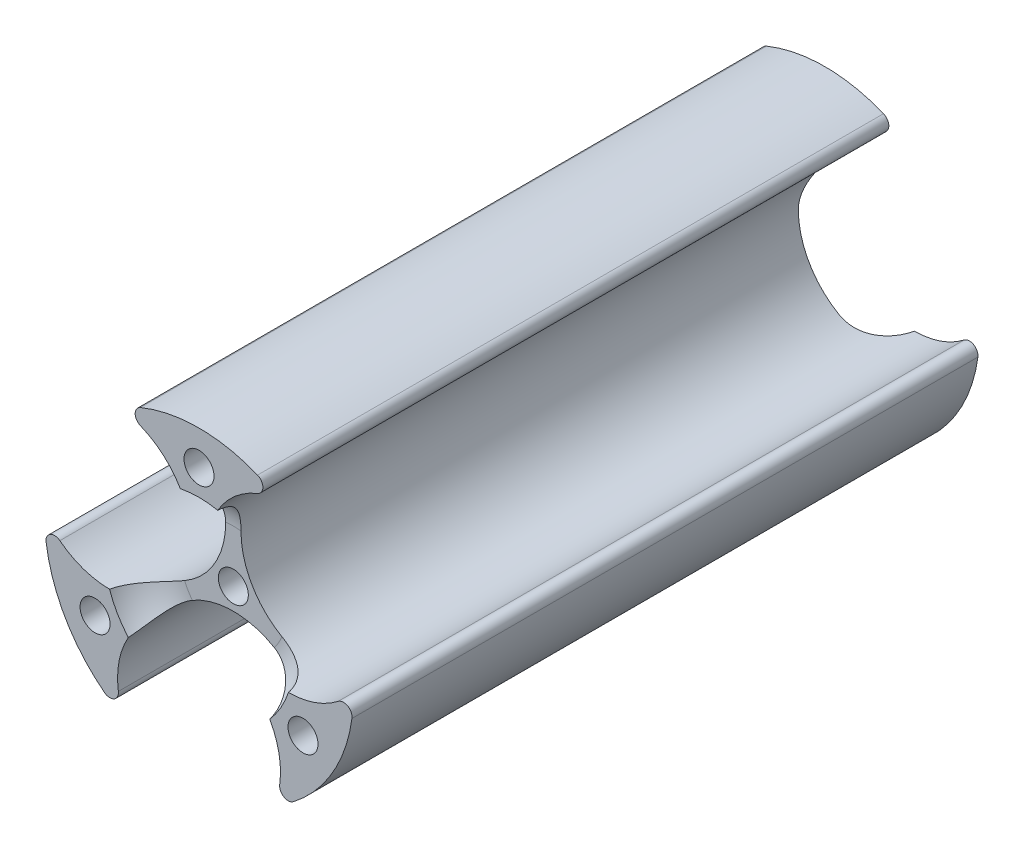
from build123d import *

# Parameters (mm, degrees)
SKETCH_1_R      = 1.75
EXTRUDE_1_DEPTH = 65
FILLET_1_R      = 1
SKETCH_2_R      = 1.75
EXTRUDE_2_DEPTH = 4
FILLET_2_R      = 5
EXTRUDE_START   = 4
SKETCH_3_R      = 1.75
EXTRUDE_3_DEPTH = 4
FILLET_3_R      = 5


with BuildPart() as part:
    # Эскиз1 → Бобышка-Вытянуть1 (new body)
    with BuildSketch(Plane.XY):
        with BuildLine():
            ThreePointArc((8.733013025, -15.739583333), (15.511193288, -9.132517877), (18, 0))
            ThreePointArc((18, 0), (17.999346369, 0.153395838), (17.997385524, 0.306780536))
            ThreePointArc((17.997385524, 0.306780536), (2.165063509, 1.25), (9.264372499, 15.432802798))
            ThreePointArc((9.264372499, 15.432802798), (0, 18), (-9.264372499, 15.432802798))
            ThreePointArc((-9.264372499, 15.432802798), (-3.287188474, 12.30613363), (-0.892304845, 6))
            ThreePointArc((-0.892304845, 6), (-7.392160386, -3.013830108), (-17.997385524, 0.306780536))
            ThreePointArc((-17.997385524, 0.306780536), (-15.588457268, -9), (-8.733013025, -15.739583333))
            ThreePointArc((-8.733013025, -15.739583333), (-1.908713738, -2.693721911), (9.5, -12))
            ThreePointArc((9.5, -12), (9.306278089, -13.908713738), (8.733013025, -15.739583333))
        make_face()
        with Locations((-12.124355653, -7)):
            Circle(SKETCH_1_R, mode=Mode.SUBTRACT)
        with Locations((12.124355653, -7)):
            Circle(SKETCH_1_R, mode=Mode.SUBTRACT)
        Circle(SKETCH_1_R, mode=Mode.SUBTRACT)
        with Locations((0, 14)):
            Circle(SKETCH_1_R, mode=Mode.SUBTRACT)
    extrude(amount=EXTRUDE_1_DEPTH)

    # Скругление1
    fillet_1_edges = [part.edges().sort_by_distance(p)[0] for p in [
        (17.997385524, 0.306780536, 32.5),
        (8.733013025, -15.739583333, 32.5),
        (-8.733013025, -15.739583333, 32.5),
        (-17.997385524, 0.306780536, 32.5),
        (-9.264372499, 15.432802798, 32.5),
        (9.264372499, 15.432802798, 32.5),
    ]]
    fillet(fillet_1_edges, radius=FILLET_1_R)

    # Эскиз2 → Бобышка-Вытянуть2 (add)
    # profile 1 of 3: a face of its own
    with BuildSketch(Plane.XY.offset(65)):
        with BuildLine():
            ThreePointArc((6.822193962, 14.803653121), (7.446391133, 15.728518462), (6.825592394, 16.655668359))
            ThreePointArc((6.825592394, 16.655668359), (0, 18), (-6.825592394, 16.655668359))
            ThreePointArc((-6.825592394, 16.655668359), (-7.446391133, 15.728518462), (-6.822193962, 14.803653121))
            ThreePointArc((-6.822193962, 14.803653121), (-4.168730882, 13.177543251), (-2.183145185, 10.781181619))
            ThreePointArc((-2.183145185, 10.781181619), (0, 11), (2.183145185, 10.781181619))
            ThreePointArc((2.183145185, 10.781181619), (4.168730882, 13.177543251), (6.822193962, 14.803653121))
        make_face()
        with Locations((0, 14)):
            Circle(SKETCH_2_R, mode=Mode.SUBTRACT)
    # profile 2 of 3: a face of its own
    with BuildSketch(Plane.XY.offset(65)):
        with BuildLine():
            ThreePointArc((17.837028113, -2.41669777), (17.344492118, -1.415495343), (16.231436653, -1.49363328))
            ThreePointArc((16.231436653, -1.49363328), (13.496452656, -2.97854478), (10.428349757, -3.499931619))
            ThreePointArc((10.428349757, -3.499931619), (9.526279442, -5.5), (8.245204572, -7.28125))
            ThreePointArc((8.245204572, -7.28125), (9.1809434, -9.558631883), (9.5, -12))
            ThreePointArc((9.5, -12), (9.477283513, -12.656579941), (9.409242691, -13.310019841))
            ThreePointArc((9.409242691, -13.310019841), (9.898100985, -14.313023118), (11.011435719, -14.238970588))
            ThreePointArc((11.011435719, -14.238970588), (15.588457268, -9), (17.837028113, -2.41669777))
        make_face()
        with Locations((12.124355653, -7)):
            Circle(SKETCH_2_R, mode=Mode.SUBTRACT)
    # profile 3 of 3: a face of its own
    with BuildSketch(Plane.XY.offset(65)):
        with BuildLine():
            ThreePointArc((-10.428349757, -3.499931619), (-13.496452656, -2.97854478), (-16.231436653, -1.49363328))
            ThreePointArc((-16.231436653, -1.49363328), (-17.344492118, -1.415495343), (-17.837028113, -2.41669777))
            ThreePointArc((-17.837028113, -2.41669777), (-15.588457268, -9), (-11.011435719, -14.238970588))
            ThreePointArc((-11.011435719, -14.238970588), (-9.898100985, -14.313023118), (-9.409242691, -13.310019841))
            ThreePointArc((-9.409242691, -13.310019841), (-9.327721774, -10.198998471), (-8.245204572, -7.28125))
            ThreePointArc((-8.245204572, -7.28125), (-9.526279442, -5.5), (-10.428349757, -3.499931619))
        make_face()
        with Locations((-12.124355653, -7)):
            Circle(SKETCH_2_R, mode=Mode.SUBTRACT)
    extrude(amount=EXTRUDE_2_DEPTH)

    # Скругление2
    # the kernel refuses this fillet: 5 mm, written as the material it adds along each edge
    with BuildSketch(Plane(origin=(0, 0, 65), x_dir=(0.26290330045081145, -0.9648221880803066, 0), z_dir=(0.9648221880803066, 0.26290330045081145, 0))) as fillet_2_piece_1_section:
        with BuildLine():
            CenterArc((6.101020514, -5), FILLET_2_R, 11.536959033, 78.463040967)
            Line((6.101020514, 0), (6.101020514, 0.1))
            Line((6.101020514, 0.1), (11, 0.1))
            Line((11, 0.1), (11.1, 0))
            ThreePointArc((11.1, 0), (11.1, -2), (11.09797959, -3.98))
            Line((11.09797959, -3.98), (11, -4))
        make_face()
    fillet_2_piece_1 = revolve(axis=Axis((0, 0, 65), (0, 0, -1)), revolution_arc=150.484807428, mode=Mode.PRIVATE)
    fillet_2_piece_1 = fillet_2_piece_1 - Plane(origin=(-10.392304845, 6, 66.122013519), x_dir=(0.1187297206541081, 0.9929266102957446, 0), z_dir=(0, 0, -1)) * Cylinder(9.5, 45, mode=Mode.PRIVATE)
    fillet_2_piece_1 = fillet_2_piece_1 - Plane(origin=(0, -12, 66.122013519), x_dir=(-0.9192645289367253, -0.3936403508772196, 0), z_dir=(0, 0, -1)) * Cylinder(9.5, 45, mode=Mode.PRIVATE)
    add(fillet_2_piece_1)
    with BuildSketch(Plane(origin=(0, 0, 65), x_dir=(0.7041088747870229, 0.7100920309693333, 0), z_dir=(-0.7100920309693333, 0.7041088747870229, 0))) as fillet_2_piece_2_section:
        with BuildLine():
            CenterArc((6.101020514, -5), FILLET_2_R, 11.536959033, 78.463040967)
            Line((11, -4), (11.09797959, -3.98))
            ThreePointArc((11.09797959, -3.98), (11.1, -2), (11.1, 0))
            Line((11.1, 0), (11, 0.1))
            Line((11, 0.1), (6.101020514, 0.1))
            Line((6.101020514, 0.1), (6.101020514, 0))
        make_face()
    fillet_2_piece_2 = revolve(axis=Axis((0, 0, 65), (0, 0, -1)), revolution_arc=150.484807428, mode=Mode.PRIVATE)
    fillet_2_piece_2 = fillet_2_piece_2 - Plane(origin=(10.392304845, 6, 66.122013516), x_dir=(0.8005348082826462, -0.5992862594185411, 0), z_dir=(0, 0, -1)) * Cylinder(9.5, 45, mode=Mode.PRIVATE)
    fillet_2_piece_2 = fillet_2_piece_2 - Plane(origin=(0, -12, 66.122013516), x_dir=(-0.9192645289367253, -0.3936403508772196, 0), z_dir=(0, 0, -1)) * Cylinder(9.5, 45, mode=Mode.PRIVATE)
    add(fillet_2_piece_2)
    with BuildSketch(Plane(origin=(0, 0, 65), x_dir=(-0.9670121752378409, 0.2547301571109701, 0), z_dir=(-0.2547301571109701, -0.9670121752378409, 0))) as fillet_2_piece_3_section:
        with BuildLine():
            CenterArc((6.101020514, -5), FILLET_2_R, 11.536959033, 78.463040967)
            Line((6.101020514, 0), (6.101020514, 0.1))
            Line((6.101020514, 0.1), (11, 0.1))
            Line((11, 0.1), (11.1, 0))
            ThreePointArc((11.1, 0), (11.1, -2), (11.09797959, -3.98))
            Line((11.09797959, -3.98), (11, -4))
        make_face()
    fillet_2_piece_3 = revolve(axis=Axis((0, 0, 65), (0, 0, -1)), revolution_arc=150.484807428, mode=Mode.PRIVATE)
    fillet_2_piece_3 = fillet_2_piece_3 - Plane(origin=(10.392304845, 6, 66.122013519), x_dir=(0.8005348082826462, -0.5992862594185411, 0), z_dir=(0, 0, -1)) * Cylinder(9.5, 45, mode=Mode.PRIVATE)
    fillet_2_piece_3 = fillet_2_piece_3 - Plane(origin=(-10.392304845, 6, 66.122013519), x_dir=(0.1187297206541081, 0.9929266102957446, 0), z_dir=(0, 0, -1)) * Cylinder(9.5, 45, mode=Mode.PRIVATE)
    add(fillet_2_piece_3)

    # Эскиз3 → Бобышка-Вытянуть3 (add)
    # profile 1 of 3: a face of its own
    with BuildSketch(Plane(origin=(0, 0, 0), x_dir=(-1, 0, 0), z_dir=(0, 0, -1)).offset(EXTRUDE_START)):
        with BuildLine():
            ThreePointArc((-2.183145185, 10.781181619), (0, 11), (2.183145185, 10.781181619))
            ThreePointArc((2.183145185, 10.781181619), (4.168730882, 13.177543251), (6.822193962, 14.803653121))
            ThreePointArc((6.822193962, 14.803653121), (7.446391133, 15.728518462), (6.825592394, 16.655668359))
            ThreePointArc((6.825592394, 16.655668359), (0, 18), (-6.825592394, 16.655668359))
            ThreePointArc((-6.825592394, 16.655668359), (-7.446391133, 15.728518462), (-6.822193962, 14.803653121))
            ThreePointArc((-6.822193962, 14.803653121), (-4.168730882, 13.177543251), (-2.183145185, 10.781181619))
        make_face()
        with Locations((0, 14)):
            Circle(SKETCH_3_R, mode=Mode.SUBTRACT)
    # profile 2 of 3: a face of its own
    with BuildSketch(Plane(origin=(0, 0, 0), x_dir=(-1, 0, 0), z_dir=(0, 0, -1)).offset(EXTRUDE_START)):
        with BuildLine():
            ThreePointArc((-8.245204572, -7.28125), (-9.526279442, -5.5), (-10.428349757, -3.499931619))
            ThreePointArc((-10.428349757, -3.499931619), (-13.496452656, -2.97854478), (-16.231436653, -1.49363328))
            ThreePointArc((-16.231436653, -1.49363328), (-17.344492118, -1.415495343), (-17.837028113, -2.41669777))
            ThreePointArc((-17.837028113, -2.41669777), (-15.588457268, -9), (-11.011435719, -14.238970588))
            ThreePointArc((-11.011435719, -14.238970588), (-9.898100985, -14.313023118), (-9.409242691, -13.310019841))
            ThreePointArc((-9.409242691, -13.310019841), (-9.327721774, -10.198998471), (-8.245204572, -7.28125))
        make_face()
        with Locations((-12.124355653, -7)):
            Circle(SKETCH_3_R, mode=Mode.SUBTRACT)
    # profile 3 of 3: a face of its own
    with BuildSketch(Plane(origin=(0, 0, 0), x_dir=(-1, 0, 0), z_dir=(0, 0, -1)).offset(EXTRUDE_START)):
        with BuildLine():
            ThreePointArc((16.231436653, -1.49363328), (13.496452656, -2.97854478), (10.428349757, -3.499931619))
            ThreePointArc((10.428349757, -3.499931619), (9.526279442, -5.5), (8.245204572, -7.28125))
            ThreePointArc((8.245204572, -7.28125), (9.327721774, -10.198998471), (9.409242691, -13.310019841))
            ThreePointArc((9.409242691, -13.310019841), (9.898100985, -14.313023118), (11.011435719, -14.238970588))
            ThreePointArc((11.011435719, -14.238970588), (15.588457268, -9), (17.837028113, -2.41669777))
            ThreePointArc((17.837028113, -2.41669777), (17.344492118, -1.415495343), (16.231436653, -1.49363328))
        make_face()
        with Locations((12.124355653, -7)):
            Circle(SKETCH_3_R, mode=Mode.SUBTRACT)
    extrude(amount=-EXTRUDE_3_DEPTH)

    # Скругление3
    # the kernel refuses this fillet: 5 mm, written as the material it adds along each edge
    with BuildSketch(Plane(origin=(0, 0, 0), x_dir=(-0.26290330045081245, -0.9648221880803063, 0), z_dir=(-0.9648221880803063, 0.26290330045081245, 0))) as fillet_3_piece_1_section:
        with BuildLine():
            CenterArc((6.101020514, -5), FILLET_3_R, 11.536959033, 78.463040967)
            Line((11, -4), (11.09797959, -3.98))
            ThreePointArc((11.09797959, -3.98), (11.1, -2), (11.1, 0))
            Line((11.1, 0), (11, 0.1))
            Line((11, 0.1), (6.101020514, 0.1))
            Line((6.101020514, 0.1), (6.101020514, 0))
        make_face()
    fillet_3_piece_1 = revolve(axis=Axis((0, 0, 0), (0, 0, 1)), revolution_arc=150.484807428, mode=Mode.PRIVATE)
    fillet_3_piece_1 = fillet_3_piece_1 - Plane(origin=(0, -12, -1.122013516), x_dir=(-0.9192645289367253, -0.3936403508772196, 0), z_dir=(0, 0, -1)) * Cylinder(9.5, 45, mode=Mode.PRIVATE)
    fillet_3_piece_1 = fillet_3_piece_1 - Plane(origin=(10.392304845, 6, -1.122013516), x_dir=(0.8005348082826462, -0.5992862594185411, 0), z_dir=(0, 0, -1)) * Cylinder(9.5, 45, mode=Mode.PRIVATE)
    add(fillet_3_piece_1)
    with BuildSketch(Plane(origin=(0, 0, 0), x_dir=(0.9670121752378399, 0.25473015711097347, 0), z_dir=(0.25473015711097347, -0.9670121752378399, 0))) as fillet_3_piece_2_section:
        with BuildLine():
            CenterArc((6.101020514, -5), FILLET_3_R, 11.536959033, 78.463040967)
            Line((11, -4), (11.09797959, -3.98))
            ThreePointArc((11.09797959, -3.98), (11.1, -2), (11.1, 0))
            Line((11.1, 0), (11, 0.1))
            Line((11, 0.1), (6.101020514, 0.1))
            Line((6.101020514, 0.1), (6.101020514, 0))
        make_face()
    fillet_3_piece_2 = revolve(axis=Axis((0, 0, 0), (0, 0, 1)), revolution_arc=150.484807428, mode=Mode.PRIVATE)
    fillet_3_piece_2 = fillet_3_piece_2 - Plane(origin=(-10.392304845, 6, -1.122013516), x_dir=(0.1187297206541081, 0.9929266102957446, 0), z_dir=(0, 0, -1)) * Cylinder(9.5, 45, mode=Mode.PRIVATE)
    fillet_3_piece_2 = fillet_3_piece_2 - Plane(origin=(10.392304845, 6, -1.122013516), x_dir=(0.8005348082826462, -0.5992862594185411, 0), z_dir=(0, 0, -1)) * Cylinder(9.5, 45, mode=Mode.PRIVATE)
    add(fillet_3_piece_2)
    with BuildSketch(Plane(origin=(0, 0, 0), x_dir=(-0.7041088747870177, 0.7100920309693384, 0), z_dir=(0.7100920309693384, 0.7041088747870177, 0))) as fillet_3_piece_3_section:
        with BuildLine():
            CenterArc((6.101020514, -5), FILLET_3_R, 11.536959033, 78.463040967)
            Line((11, -4), (11.09797959, -3.98))
            ThreePointArc((11.09797959, -3.98), (11.1, -2), (11.1, 0))
            Line((11.1, 0), (11, 0.1))
            Line((11, 0.1), (6.101020514, 0.1))
            Line((6.101020514, 0.1), (6.101020514, 0))
        make_face()
    fillet_3_piece_3 = revolve(axis=Axis((0, 0, 0), (0, 0, 1)), revolution_arc=150.484807428, mode=Mode.PRIVATE)
    fillet_3_piece_3 = fillet_3_piece_3 - Plane(origin=(0, -12, -1.122013516), x_dir=(-0.9192645289367253, -0.3936403508772196, 0), z_dir=(0, 0, -1)) * Cylinder(9.5, 45, mode=Mode.PRIVATE)
    fillet_3_piece_3 = fillet_3_piece_3 - Plane(origin=(-10.392304845, 6, -1.122013516), x_dir=(0.1187297206541081, 0.9929266102957446, 0), z_dir=(0, 0, -1)) * Cylinder(9.5, 45, mode=Mode.PRIVATE)
    add(fillet_3_piece_3)


solid = part.part
